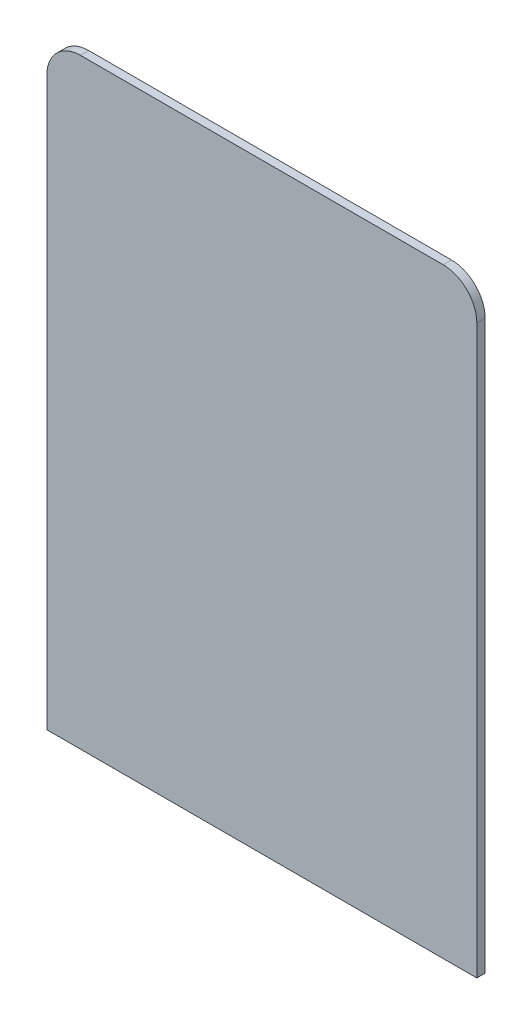
from build123d import *

# Parameters (mm, degrees)
EXTRUDE_1_DEPTH = 0.8


with BuildPart() as part:
    # 草图1 → 凸台-拉伸1 (new body)
    with BuildSketch(Plane.XY):
        with BuildLine():
            Line((-41.75, 66.25), (-6.75, 66.25))
            ThreePointArc((-6.75, 66.25), (-4.451902961, 65.298097039), (-3.5, 63))
            Line((-3.5, 63), (-3.5, 8.25))
            Line((-3.5, 8.25), (-45, 8.25))
            Line((-45, 8.25), (-45, 63))
            ThreePointArc((-45, 63), (-44.048097039, 65.298097039), (-41.75, 66.25))
        make_face()
    extrude(amount=EXTRUDE_1_DEPTH)


solid = part.part
